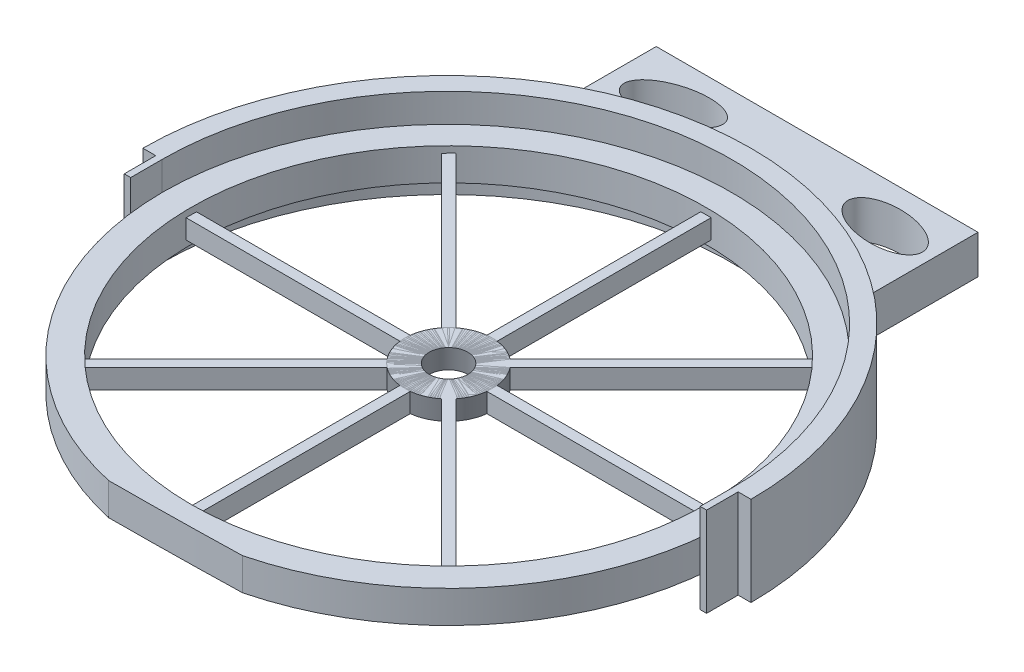
from build123d import *

# Parameters (mm, degrees)
BOSS_EXTRUDE1_DEPTH      = 13.9
SKETCH2_W                = 1
SKETCH2_H                = 13.9
BOSS_EXTRUDE2_DEPTH      = 4.9
BOSS_EXTRUDE3_DEPTH      = 2.5
BOSS_EXTRUDE3_DEPTH_BACK = 2.5
SKETCH5_R                = 44.25
SKETCH5_R_2              = 40
BOSS_EXTRUDE4_DEPTH      = 1.5
BOSS_EXTRUDE4_DEPTH_BACK = 1.5
SKETCH6_R                = 3
CIRPATTERN6_COUNT        = 8
CUT_EXTRUDE3_DEPTH       = 6.5
BOSS_EXTRUDE5_START      = -57.524525956
BOSS_EXTRUDE5_OUTLINE_W  = 50
BOSS_EXTRUDE5_OUTLINE_H  = 6
BOSS_EXTRUDE5_DEPTH      = 17.430106145
BOSS_EXTRUDE5_START_2    = 3.95
BOSS_EXTRUDE5_2_DEPTH    = 6
BOSS_EXTRUDE5_3_DEPTH    = 0.5
BOSS_EXTRUDE5_START_3    = 9.45
BOSS_EXTRUDE5_4_DEPTH    = 0.5
BOSS_EXTRUDE5_START_4    = 4.45
BOSS_EXTRUDE5_5_DEPTH    = 1
BOSS_EXTRUDE5_START_5    = 8.45
BOSS_EXTRUDE5_6_DEPTH    = 1


with BuildPart() as part:
    # Sketch1 → Boss-Extrude1 (new body)
    with BuildSketch(Plane(origin=(0, 0, 0), x_dir=(1, 0, 0), z_dir=(0, 1, 0))):
        with BuildLine():
            Line((-47.25, 0), (-44.25, 0))
            ThreePointArc((-44.25, 0), (0, 44.25), (44.25, 0))
            Line((44.25, 0), (47.25, 0))
            ThreePointArc((47.25, 0), (0, 47.25), (-47.25, 0))
        make_face()
    extrude(amount=BOSS_EXTRUDE1_DEPTH)

    # Sketch2 → Boss-Extrude2 (add)
    with BuildSketch(Plane.XY):
        with Locations((-44.75, 6.95)):
            Rectangle(SKETCH2_W, SKETCH2_H)
    boss_extrude2 = extrude(amount=BOSS_EXTRUDE2_DEPTH)

    # Mirror1: Boss-Extrude2 across plane
    add(boss_extrude2.mirror(Plane(origin=(0, 0, 0), x_dir=(0, 0, 1), z_dir=(1, 0, 0))))

    # Sketch5 → Boss-Extrude3 (add, two sides: drawn at the far end of the back side and taken through both)
    with BuildSketch(Plane(origin=(0, 6.95, 0), x_dir=(1, 0, 0), z_dir=(0, 1, 0)).offset(-BOSS_EXTRUDE3_DEPTH_BACK)):
        with Locations((0, 0.25)):
            Circle(SKETCH5_R)
        with Locations(Location((0, 0.25, 0), (0, 0, 270))):
            Circle(SKETCH5_R_2, mode=Mode.SUBTRACT)
    extrude(amount=BOSS_EXTRUDE3_DEPTH + BOSS_EXTRUDE3_DEPTH_BACK)

    # Sketch13 → Cut-Extrude3 (cut)
    with BuildSketch(Plane.XZ.offset(-4.45)):
        with BuildLine():
            ThreePointArc((-9.632658615, 42.938822489), (0.629601632, 42.849609407), (10.89008888, 42.639024985))
            ThreePointArc((10.89008888, 42.639024985), (0.646337647, 43.995279383), (-9.632658615, 42.938822489))
        make_face()
    extrude(amount=-CUT_EXTRUDE3_DEPTH, mode=Mode.SUBTRACT)



with BuildPart() as body_2:
    # Sketch6 → Boss-Extrude4 (new, two sides: drawn at the far end of the back side and taken through both)
    with BuildSketch(Plane(origin=(0, 6.95, 0), x_dir=(1, 0, 0), z_dir=(0, 1, 0)).offset(-BOSS_EXTRUDE4_DEPTH_BACK)):
        with BuildLine():
            Line((0.8, -6.503590715), (0.8, -41.16013429))
            Line((0.8, -41.16013429), (-0.8, -41.040239741))
            Line((-0.8, -41.040239741), (-0.8, -6.503590715))
            ThreePointArc((-0.8, -6.503590715), (0, 7.05080786), (0.8, -6.503590715))
        make_face()
        with Locations(Location((0, 0.25, 0), (0, 0, 270))):
            Circle(SKETCH6_R, mode=Mode.SUBTRACT)
    extrude(amount=BOSS_EXTRUDE4_DEPTH + BOSS_EXTRUDE4_DEPTH_BACK)


with BuildPart() as cirpattern6_1:
    # CirPattern6: pattern copy
    add(body_2.part.rotate(Axis((0, 0, -0.25), (0, 1, 0)), 1 * 360 / CIRPATTERN6_COUNT))


with BuildPart() as cirpattern6_2:
    # CirPattern6: pattern copy
    add(body_2.part.rotate(Axis((0, 0, -0.25), (0, 1, 0)), 2 * 360 / CIRPATTERN6_COUNT))


with BuildPart() as cirpattern6_3:
    # CirPattern6: pattern copy
    add(body_2.part.rotate(Axis((0, 0, -0.25), (0, 1, 0)), 3 * 360 / CIRPATTERN6_COUNT))


with BuildPart() as cirpattern6_4:
    # CirPattern6: pattern copy
    add(body_2.part.rotate(Axis((0, 0, -0.25), (0, 1, 0)), 4 * 360 / CIRPATTERN6_COUNT))


with BuildPart() as cirpattern6_5:
    # CirPattern6: pattern copy
    add(body_2.part.rotate(Axis((0, 0, -0.25), (0, 1, 0)), 5 * 360 / CIRPATTERN6_COUNT))


with BuildPart() as cirpattern6_6:
    # CirPattern6: pattern copy
    add(body_2.part.rotate(Axis((0, 0, -0.25), (0, 1, 0)), 6 * 360 / CIRPATTERN6_COUNT))


with BuildPart() as cirpattern6_7:
    # CirPattern6: pattern copy
    add(body_2.part.rotate(Axis((0, 0, -0.25), (0, 1, 0)), 7 * 360 / CIRPATTERN6_COUNT))


with BuildPart() as part_1:
    add(part.part)

    add(cirpattern6_4.part)  # Boss-Extrude5 merges CirPattern6_4
    # Boss-Extrude5: read off the stored shape, not the designer's step
    # Boss-Extrude5 outline → Boss-Extrude5 (add)
    with BuildSketch(Plane.XY.offset(BOSS_EXTRUDE5_START)):
        with Locations((0, 6.95)):
            Rectangle(BOSS_EXTRUDE5_OUTLINE_W, BOSS_EXTRUDE5_OUTLINE_H)
    extrude(amount=BOSS_EXTRUDE5_DEPTH)

    # Boss-Extrude5 2 outline → Boss-Extrude5 2 (cut)
    with BuildSketch(Plane(origin=(0, 0, 0), x_dir=(1, 0, 0), z_dir=(0, 1, 0)).offset(BOSS_EXTRUDE5_START_2)):
        with BuildLine():
            add(Edge.make_bspline(
                [(23.337479062, 50.335967124), (24.05424607, 56.109110558), (14.157071661, 54.406831366), (4.259897252, 52.704552175), (13.440304653, 48.633687932), (22.620712054, 44.562823689), (23.337479062, 50.335967124)],
                knots=[0, 0, 0, 2.094395102, 2.094395102, 4.188790205, 4.188790205, 6.283185307, 6.283185307, 6.283185307], degree=2, weights=[1, 0.5, 1, 0.5, 1, 0.5, 1]))
        make_face()
        with BuildLine():
            add(Edge.make_bspline(
                [(-9.387323733, 52.591539123), (-10.640360061, 58.272458064), (-19.859751334, 53.260293217), (-29.079142607, 48.24812837), (-18.606715006, 47.579374276), (-8.134287405, 46.910620181), (-9.387323733, 52.591539123)],
                knots=[0, 0, 0, 2.094395102, 2.094395102, 4.188790205, 4.188790205, 6.283185307, 6.283185307, 6.283185307], degree=2, weights=[1, 0.5, 1, 0.5, 1, 0.5, 1]))
        make_face()
        with BuildLine():
            Line((0.8, 40.094419811), (3.524515559, 40.094419811))
            ThreePointArc((3.524515559, 40.094419811), (2.163516495, 40.191447099), (0.8, 40.2419992))
            Line((0.8, 40.2419992), (0.8, 40.094419811))
        make_face()
        with BuildLine():
            Line((-0.8, 40.094419811), (-0.8, 40.2419992))
            ThreePointArc((-0.8, 40.2419992), (-2.163516495, 40.191447099), (-3.524515559, 40.094419811))
            Line((-3.524515559, 40.094419811), (-0.8, 40.094419811))
        make_face()
    extrude(amount=BOSS_EXTRUDE5_2_DEPTH, mode=Mode.SUBTRACT)

    # Boss-Extrude5 3 outline → Boss-Extrude5 3 (cut)
    with BuildSketch(Plane(origin=(0, 0, 0), x_dir=(1, 0, 0), z_dir=(0, 1, 0)).offset(BOSS_EXTRUDE5_START_2)):
        with BuildLine():
            ThreePointArc((0.8, 40.2419992), (2.163516495, 40.191447099), (3.524515559, 40.094419811))
            Line((3.524515559, 40.094419811), (18.721645227, 40.094419811))
            ThreePointArc((18.721645227, 40.094419811), (0, 44.25), (-18.721645227, 40.094419811))
            Line((-18.721645227, 40.094419811), (-3.524515559, 40.094419811))
            ThreePointArc((-3.524515559, 40.094419811), (-2.163516495, 40.191447099), (-0.8, 40.2419992))
            Line((-0.8, 40.2419992), (-0.8, 40.094419811))
            Line((-0.8, 40.094419811), (0.8, 40.094419811))
            Line((0.8, 40.094419811), (0.8, 40.2419992))
        make_face()
    extrude(amount=BOSS_EXTRUDE5_3_DEPTH, mode=Mode.SUBTRACT)

    # Boss-Extrude5 4 outline → Boss-Extrude5 4 (cut)
    with BuildSketch(Plane(origin=(0, 0, 0), x_dir=(1, 0, 0), z_dir=(0, 1, 0)).offset(BOSS_EXTRUDE5_START_3)):
        with BuildLine():
            ThreePointArc((0.8, 40.2419992), (2.163516495, 40.191447099), (3.524515559, 40.094419811))
            Line((3.524515559, 40.094419811), (18.721645227, 40.094419811))
            ThreePointArc((18.721645227, 40.094419811), (0, 44.25), (-18.721645227, 40.094419811))
            Line((-18.721645227, 40.094419811), (-3.524515559, 40.094419811))
            ThreePointArc((-3.524515559, 40.094419811), (-2.163516495, 40.191447099), (-0.8, 40.2419992))
            Line((-0.8, 40.2419992), (-0.8, 40.094419811))
            Line((-0.8, 40.094419811), (0.8, 40.094419811))
            Line((0.8, 40.094419811), (0.8, 40.2419992))
        make_face()
    extrude(amount=BOSS_EXTRUDE5_4_DEPTH, mode=Mode.SUBTRACT)

    # Boss-Extrude5 5 outline → Boss-Extrude5 5 (cut)
    with BuildSketch(Plane(origin=(0, 0, 0), x_dir=(1, 0, 0), z_dir=(0, 1, 0)).offset(BOSS_EXTRUDE5_START_4)):
        with BuildLine():
            Line((0.8, 40.094419811), (0.8, 40.2419992))
            ThreePointArc((0.8, 40.2419992), (0, 40.25), (-0.8, 40.2419992))
            Line((-0.8, 40.2419992), (-0.8, 40.094419811))
            Line((-0.8, 40.094419811), (0.8, 40.094419811))
        make_face()
    extrude(amount=BOSS_EXTRUDE5_5_DEPTH, mode=Mode.SUBTRACT)

    # Boss-Extrude5 6 outline → Boss-Extrude5 6 (cut)
    with BuildSketch(Plane(origin=(0, 0, 0), x_dir=(1, 0, 0), z_dir=(0, 1, 0)).offset(BOSS_EXTRUDE5_START_5)):
        with BuildLine():
            Line((0.8, 40.094419811), (0.8, 40.2419992))
            ThreePointArc((0.8, 40.2419992), (0, 40.25), (-0.8, 40.2419992))
            Line((-0.8, 40.2419992), (-0.8, 40.094419811))
            Line((-0.8, 40.094419811), (0.8, 40.094419811))
        make_face()
    extrude(amount=BOSS_EXTRUDE5_6_DEPTH, mode=Mode.SUBTRACT)


solid = Compound([body_2.part, cirpattern6_1.part, cirpattern6_2.part, cirpattern6_3.part, cirpattern6_5.part, cirpattern6_6.part, cirpattern6_7.part, part_1.part])
